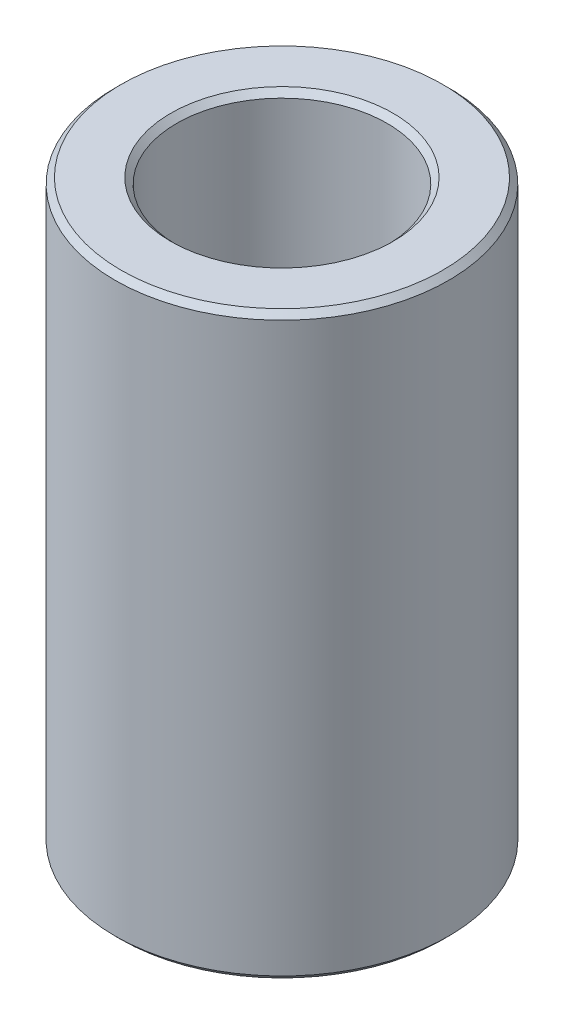
from build123d import *

# Parameters (mm, degrees)
SKETCH1_R           = 30
BOSS_EXTRUDE1_DEPTH = 104.266360563
SKETCH2_R           = 18.935491914
CUT_EXTRUDE1_DEPTH  = 113.567641643
CHAMFER1_SIZE       = 1.055377007


with BuildPart() as part:
    # Sketch1 → Boss-Extrude1 (new body)
    with BuildSketch(Plane(origin=(0, 0, 0), x_dir=(1, 0, 0), z_dir=(0, 1, 0))):
        Circle(SKETCH1_R)
    extrude(amount=BOSS_EXTRUDE1_DEPTH)

    # Sketch2 → Cut-Extrude1 (cut, through all)
    with BuildSketch(Plane(origin=(0, 0, 0), x_dir=(1, 0, 0), z_dir=(0, 1, 0))):
        Circle(SKETCH2_R)
    extrude(amount=CUT_EXTRUDE1_DEPTH, mode=Mode.SUBTRACT)

    # Chamfer1
    chamfer1_edges = [part.edges().sort_by_distance(p)[0] for p in [
        (-18.935491914, 104.266360563, 0),
        (-18.935491914, 0, 0),
        (-30, 0, 0),
        (-30, 104.266360563, 0),
    ]]
    chamfer(chamfer1_edges, length=CHAMFER1_SIZE)


solid = part.part
